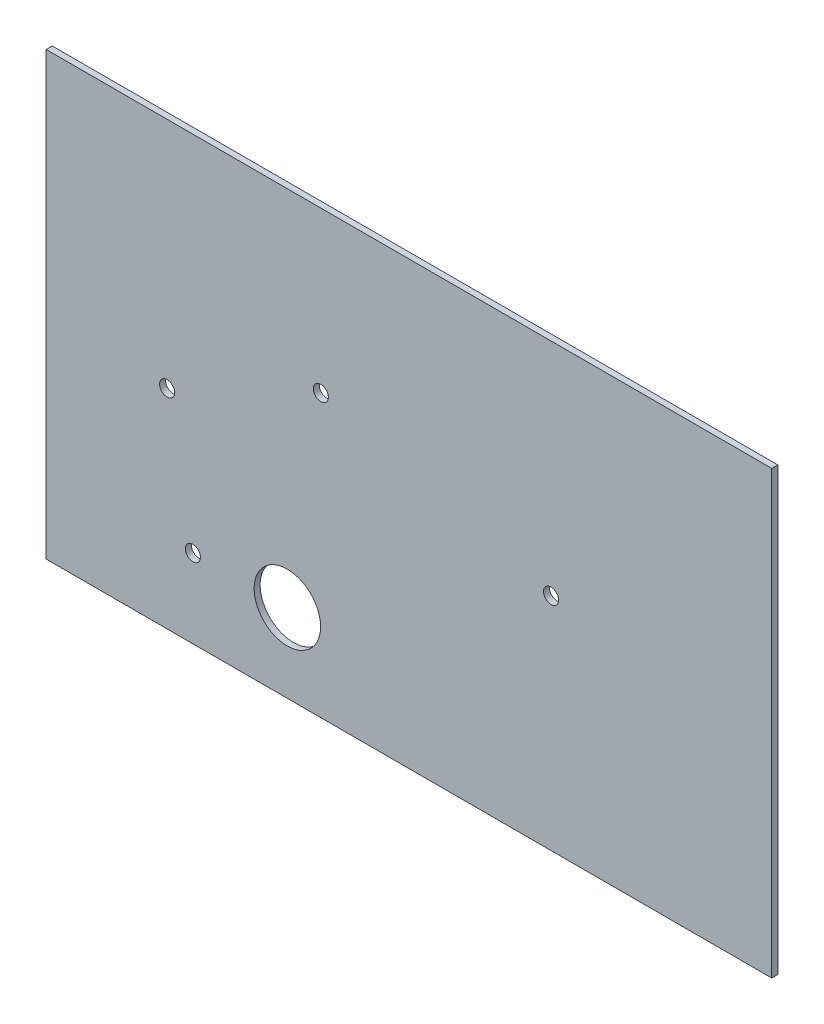
from build123d import *

# Parameters (mm, degrees)
SKETCH_1_W      = 240
SKETCH_1_H      = 146
SKETCH_1_R      = 2.5
SKETCH_1_R_2    = 11
EXTRUDE_1_DEPTH = 2


with BuildPart() as part:
    # Эскиз1 → Бобышка-Вытянуть1 (new body)
    with BuildSketch(Plane.XY):
        with Locations((120, 73)):
            Rectangle(SKETCH_1_W, SKETCH_1_H)
        with Locations((48.515350749, 26)):
            Circle(SKETCH_1_R, mode=Mode.SUBTRACT)
        with Locations((79.765350749, 26)):
            Circle(SKETCH_1_R_2, mode=Mode.SUBTRACT)
        with Locations((40, 68.913299822)):
            Circle(SKETCH_1_R, mode=Mode.SUBTRACT)
        with Locations((90.832011317, 93)):
            Circle(SKETCH_1_R, mode=Mode.SUBTRACT)
        with Locations((167, 73)):
            Circle(SKETCH_1_R, mode=Mode.SUBTRACT)
    extrude(amount=EXTRUDE_1_DEPTH)


solid = part.part
